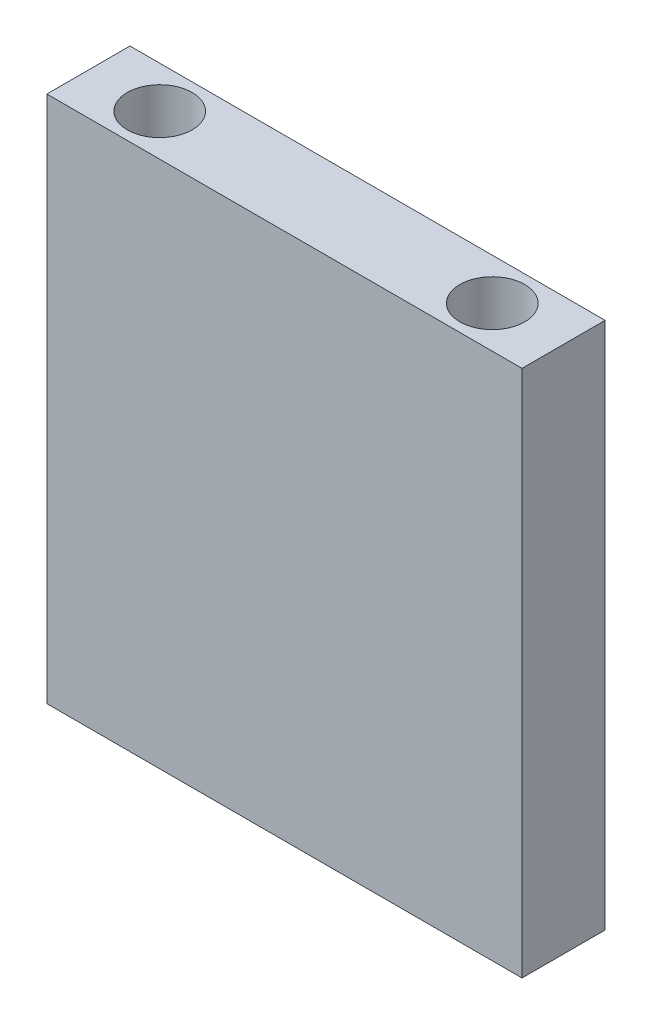
from build123d import *

# Parameters (mm, degrees)
SKETCH1_W           = 28.575
SKETCH1_H           = 31.75
BOSS_EXTRUDE1_DEPTH = 2.5
SKETCH3_R           = 1.95
CUT_EXTRUDE1_DEPTH  = 5.2


with BuildPart() as part:
    # Sketch1 → Boss-Extrude1 (new, symmetric)
    with BuildSketch(Plane.XY):
        Rectangle(SKETCH1_W, SKETCH1_H)
    extrude(amount=BOSS_EXTRUDE1_DEPTH, both=True)

    # Sketch3 → Cut-Extrude1 (cut)
    with BuildSketch(Plane(origin=(0, 15.875, 0), x_dir=(1, 0, 0), z_dir=(0, 1, 0))):
        with Locations((-10, 0)):
            Circle(SKETCH3_R)
        with Locations((10, 0)):
            Circle(SKETCH3_R)
    extrude(amount=-CUT_EXTRUDE1_DEPTH, mode=Mode.SUBTRACT)


solid = part.part
